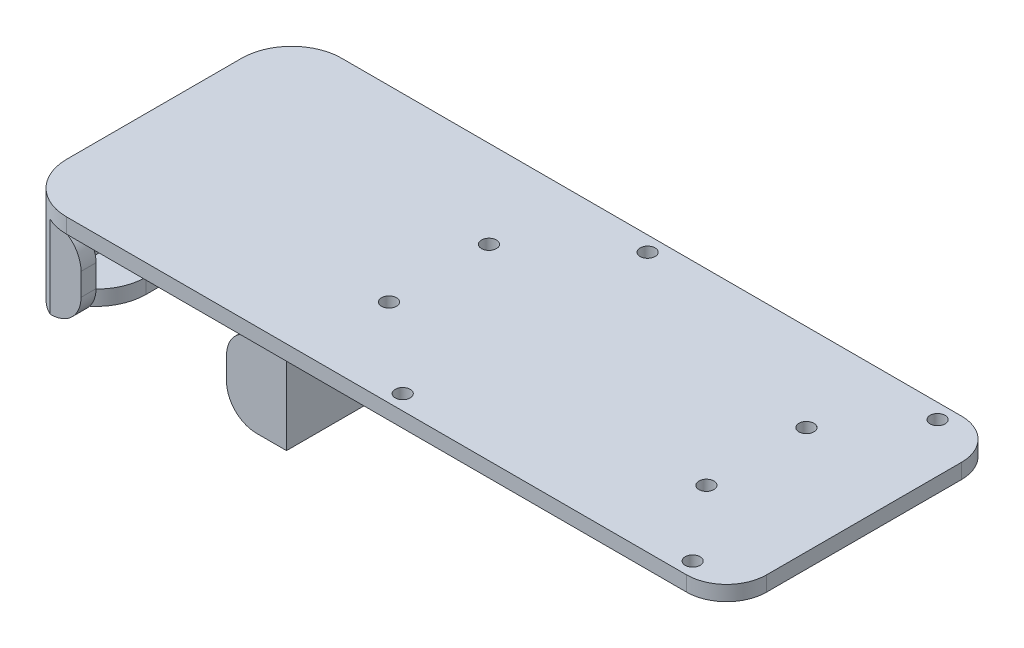
from build123d import *

# Parameters (mm, degrees)
SKETCH1_R               = 1.5
BOSS_EXTRUDE1_DEPTH     = 3
SKETCH2_R               = 1.5
CUT_EXTRUDE1_DEPTH      = 53.82281704
BOSS_EXTRUDE2_START     = -3
SKETCH3_R               = 1.5
BOSS_EXTRUDE2_DEPTH     = 3
BOSS_EXTRUDE3_START     = -16.5
BOSS_EXTRUDE3_OUTLINE_W = 3
BOSS_EXTRUDE3_OUTLINE_H = 47
BOSS_EXTRUDE3_DEPTH     = 13.5
BOSS_EXTRUDE5_DEPTH     = 3
CUT_EXTRUDE2_DEPTH      = 103.691284927
BOSS_EXTRUDE6_DEPTH     = 3
CUT_EXTRUDE3_DEPTH      = 103.691284927


# Read off the part's stored shape, not the designer's step: Boss-Extrude3
with BuildPart() as part:
    # Sketch1 → Boss-Extrude1 (new body)
    with BuildSketch(Plane(origin=(0, 0, 0), x_dir=(1, 0, 0), z_dir=(0, 1, 0))):
        with BuildLine():
            Line((37, 27.5), (-37, 27.5))
            ThreePointArc((-37, 27.5), (-42.656854249, 25.156854249), (-45, 19.5))
            Line((-45, 19.5), (-45, -19.5))
            ThreePointArc((-45, -19.5), (-42.656854249, -25.156854249), (-37, -27.5))
            Line((-37, -27.5), (37, -27.5))
            ThreePointArc((37, -27.5), (42.656854249, -25.156854249), (45, -19.5))
            Line((45, -19.5), (45, 19.5))
            ThreePointArc((45, 19.5), (42.656854249, 25.156854249), (37, 27.5))
        make_face()
        with Locations(Location((-22.790794979, 24.5, 0), (0, 0, 270))):
            Circle(SKETCH1_R, mode=Mode.SUBTRACT)
        with Locations(Location((-22.790794979, -24.5, 0), (0, 0, 270))):
            Circle(SKETCH1_R, mode=Mode.SUBTRACT)
        with Locations(Location((35.209205021, -24.5, 0), (0, 0, 270))):
            Circle(SKETCH1_R, mode=Mode.SUBTRACT)
        with Locations(Location((35.209205021, 24.5, 0), (0, 0, 270))):
            Circle(SKETCH1_R, mode=Mode.SUBTRACT)
        with Locations(Location((-40.029839799, 10, 0), (0, 0, 270))):
            Circle(SKETCH1_R, mode=Mode.SUBTRACT)
        with Locations(Location((-40.029839799, -10, 0), (0, 0, 270))):
            Circle(SKETCH1_R, mode=Mode.SUBTRACT)
    extrude(amount=BOSS_EXTRUDE1_DEPTH)

    # Sketch2 → Cut-Extrude1 (cut, through all)
    with BuildSketch(Plane(origin=(0, 3, 0), x_dir=(1, 0, 0), z_dir=(0, 1, 0))):
        with Locations(Location((23.470160201, 10, 0), (0, 0, 270))):
            Circle(SKETCH2_R)
        with Locations(Location((23.470160201, -10, 0), (0, 0, 270))):
            Circle(SKETCH2_R)
    extrude(amount=-CUT_EXTRUDE1_DEPTH, mode=Mode.SUBTRACT)

    # Sketch3 → Boss-Extrude2 (add)
    with BuildSketch(Plane(origin=(0, 3, 0), x_dir=(1, 0, 0), z_dir=(0, 1, 0)).offset(BOSS_EXTRUDE2_START)):
        with BuildLine():
            Line((-37, 27.5), (-87, 27.5))
            ThreePointArc((-87, 27.5), (-94.071067812, 24.571067812), (-97, 17.5))
            Line((-97, 17.5), (-97, -17.5))
            ThreePointArc((-97, -17.5), (-94.071067812, -24.571067812), (-87, -27.5))
            Line((-87, -27.5), (-37, -27.5))
            Line((-37, -27.5), (-37, 27.5))
        make_face()
        with Locations(Location((-40.029839799, 10, 0), (0, 0, 270))):
            Circle(SKETCH3_R, mode=Mode.SUBTRACT)
        with Locations(Location((-40.029839799, -10, 0), (0, 0, 270))):
            Circle(SKETCH3_R, mode=Mode.SUBTRACT)
    extrude(amount=BOSS_EXTRUDE2_DEPTH)

    # Boss-Extrude3 outline → Boss-Extrude3 (add)
    with BuildSketch(Plane(origin=(0, 3, 0), x_dir=(1, 0, 0), z_dir=(0, 1, 0)).offset(BOSS_EXTRUDE3_START)):
        with BuildLine():
            Line((-97, 17.5), (-97, -17.5))
            ThreePointArc((-97, -17.5), (-96.486832981, -20.66227766), (-95, -23.5))
            Line((-95, -23.5), (-94.029839799, -23.5))
            Line((-94.029839799, -23.5), (-94.029839799, 23.5))
            Line((-94.029839799, 23.5), (-95, 23.5))
            ThreePointArc((-95, 23.5), (-96.486832981, 20.66227766), (-97, 17.5))
        make_face()
        with Locations((-45.529839799, 0)):
            Rectangle(BOSS_EXTRUDE3_OUTLINE_W, BOSS_EXTRUDE3_OUTLINE_H)
    extrude(amount=BOSS_EXTRUDE3_DEPTH)

    # Sketch6 → Boss-Extrude5 (add)
    with BuildSketch(Plane.XZ.offset(13.5)):
        with BuildLine():
            Line((-44.029839799, 23.5), (-46.029839799, 23.5))
            ThreePointArc((-46.029839799, 23.5), (-53.100907611, 20.571067812), (-56.029839799, 13.5))
            Line((-56.029839799, 13.5), (-56.029839799, -13.5))
            ThreePointArc((-56.029839799, -13.5), (-53.100907611, -20.571067812), (-46.029839799, -23.5))
            Line((-46.029839799, -23.5), (-44.029839799, -23.5))
            Line((-44.029839799, -23.5), (-44.029839799, 23.5))
        make_face()
        with BuildLine():
            Line((-85.136084996, -13.5), (-85.136084996, 13.5))
            ThreePointArc((-85.136084996, 13.5), (-88.065017184, 20.571067812), (-95.136084996, 23.5))
            Line((-95.136084996, 23.5), (-97, 23.5))
            Line((-97, 23.5), (-97, -23.5))
            Line((-97, -23.5), (-95.136084996, -23.5))
            ThreePointArc((-95.136084996, -23.5), (-88.065017184, -20.571067812), (-85.136084996, -13.5))
        make_face()
    extrude(amount=BOSS_EXTRUDE5_DEPTH)

    # Sketch7 → Cut-Extrude2 (cut, through all)
    with BuildSketch(Plane(origin=(0, 3, 0), x_dir=(1, 0, 0), z_dir=(0, 1, 0))):
        with BuildLine():
            Line((-97, 27.5), (-87, 27.5))
            ThreePointArc((-87, 27.5), (-94.071067812, 24.571067812), (-97, 17.5))
            Line((-97, 17.5), (-97, 27.5))
        make_face()
        with BuildLine():
            Line((-97, -27.5), (-97, -17.5))
            ThreePointArc((-97, -17.5), (-94.071067812, -24.571067812), (-87, -27.5))
            Line((-87, -27.5), (-97, -27.5))
        make_face()
    extrude(amount=-CUT_EXTRUDE2_DEPTH, mode=Mode.SUBTRACT)

    # Sketch8 → Boss-Extrude6 (add)
    with BuildSketch(Plane.XY.offset(23.5)):
        with BuildLine():
            Line((-50.029839799, -16.5), (-46.029839799, -16.5))
            Line((-46.029839799, -16.5), (-46.029839799, -13.5))
            Line((-46.029839799, -13.5), (-47.029839799, -13.5))
            Line((-47.029839799, -13.5), (-47.029839799, -6.75))
            Line((-47.029839799, -6.75), (-56.029839799, -6.75))
            Line((-56.029839799, -6.75), (-56.029839799, -10.5))
            ThreePointArc((-56.029839799, -10.5), (-54.272480486, -14.742640687), (-50.029839799, -16.5))
        make_face()
        with BuildLine():
            Line((-47.029839799, -6.75), (-47.029839799, 0))
            Line((-47.029839799, 0), (-50.029839799, 0))
            ThreePointArc((-50.029839799, 0), (-54.272480486, -1.757359313), (-56.029839799, -6))
            Line((-56.029839799, -6), (-56.029839799, -6.75))
            Line((-56.029839799, -6.75), (-47.029839799, -6.75))
        make_face()
        Polygon((-44.029839799, -16.5), (-44.029839799, 0), (-47.029839799, 0), (-47.029839799, -13.5), (-46.029839799, -13.5), (-46.029839799, -16.5), align=None)
        with BuildLine():
            Line((-95, -6.75), (-85.136084996, -6.75))
            Line((-85.136084996, -6.75), (-85.136084996, -6))
            ThreePointArc((-85.136084996, -6), (-86.893444309, -1.757359313), (-91.136084996, 0))
            Line((-91.136084996, 0), (-95, 0))
            Line((-95, 0), (-95, -6.75))
        make_face()
        with BuildLine():
            Line((-85.136084996, -10.493579037), (-85.136084996, -6.75))
            Line((-85.136084996, -6.75), (-95, -6.75))
            Line((-95, -6.75), (-95, -16.48944967))
            Line((-95, -16.48944967), (-91.142502523, -16.493575605))
            ThreePointArc((-91.142502523, -16.493575605), (-86.895713854, -14.738488056), (-85.136084996, -10.493579037))
        make_face()
    extrude(amount=BOSS_EXTRUDE6_DEPTH)

    # Sketch9 → Cut-Extrude3 (cut, through all)
    with BuildSketch(Plane(origin=(0, 3, 0), x_dir=(1, 0, 0), z_dir=(0, 1, 0))):
        with BuildLine():
            Line((-97, -17.5), (-97, -27.5))
            Line((-97, -27.5), (-87, -27.5))
            ThreePointArc((-87, -27.5), (-94.071067812, -24.571067812), (-97, -17.5))
        make_face()
    extrude(amount=-CUT_EXTRUDE3_DEPTH, mode=Mode.SUBTRACT)


solid = part.part
